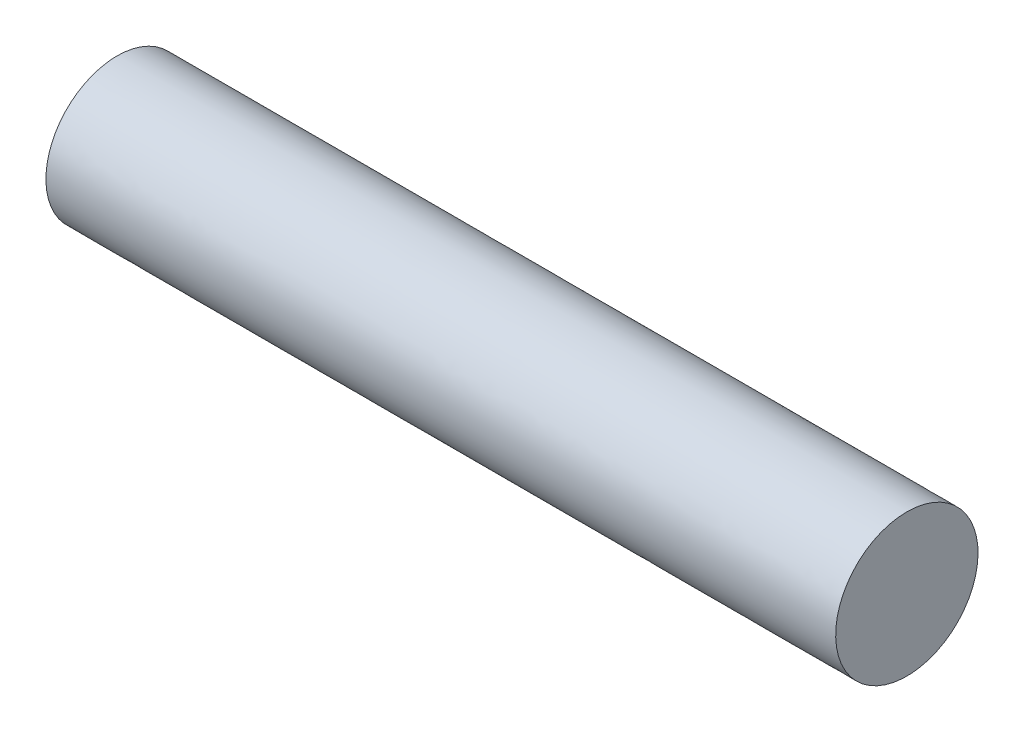
from build123d import *

# Parameters (mm, degrees)
LOFT1_START             = 259.08
LOFT1_DEPTH             = 1021.08
SCALE1_SCALE            = 0.95
CUT_EXTRUDE1_DEPTH      = 1264.579309781
CUT_EXTRUDE1_DEPTH_BACK = 1264.579309781
SKETCH11_W              = 127.806536159
SKETCH11_H              = 326.946952964


# Read off the part's stored shape, not the designer's step: Loft1
with BuildPart() as part:
    # Loft1 outline → Loft1 (new body)
    with BuildSketch(Plane.YZ.offset(LOFT1_START)):
        with BuildLine():
            add(Edge.make_bspline(
                [(131.074840176, 0), (131.074840176, 7.585349878), (129.019719734, 22.755453715), (119.988374686, 43.869012627), (105.663719284, 61.816756347), (87.077737999, 75.303505752), (65.572351994, 83.356423395), (42.699502143, 85.39357748), (20.108822767, 81.269408641), (6.324958878, 74.609028267), (-5.786480365, 66.591156976), (-16.410547257, 57.496977056), (-28.534928085, 40.377986455), (-36.116650435, 20.818386871), (-37.835159824, 6.939567352), (-37.835159824, -6.939567352), (-36.116650435, -20.818386871), (-28.534928085, -40.377986455), (-16.410547257, -57.496977056), (-5.786480365, -66.591156976), (6.324958878, -74.609028267), (20.108822767, -81.269408641), (42.699502143, -85.39357748), (65.572351994, -83.356423395), (87.077737999, -75.303505752), (105.663719284, -61.816756347), (119.988374686, -43.869012627), (129.019719734, -22.755453715), (131.074840176, -7.585349878), (131.074840176, 0)],
                knots=[0, 0, 0, 0, 0.04288364, 0.08576728, 0.12865092, 0.17153456, 0.2144182, 0.25730184, 0.30018548, 0.34306912, 0.34306912, 0.38230184, 0.42153456, 0.46076728, 0.5, 0.5, 0.53923272, 0.57846544, 0.61769816, 0.65693088, 0.65693088, 0.69981452, 0.74269816, 0.7855818, 0.82846544, 0.87134908, 0.91423272, 0.95711636, 1, 1, 1, 1], degree=3))
        make_face()
    extrude(amount=LOFT1_DEPTH)


with BuildPart() as part_1:
    # Scale1: scaled about (769.62, 46.620923177, 0)
    add(part.part.scale(SCALE1_SCALE).moved(Location((38.481, 2.331046159, 0))))

    # Sketch11 → Cut-Extrude1 (cut, two sides: drawn at the far end of the back side and taken through both)
    with BuildSketch(Plane.XY.offset(-CUT_EXTRUDE1_DEPTH_BACK)):
        with Locations((300.586080967, 16.155529454)):
            Rectangle(SKETCH11_W, SKETCH11_H)
    extrude(amount=CUT_EXTRUDE1_DEPTH + CUT_EXTRUDE1_DEPTH_BACK, mode=Mode.SUBTRACT)


solid = part_1.part
